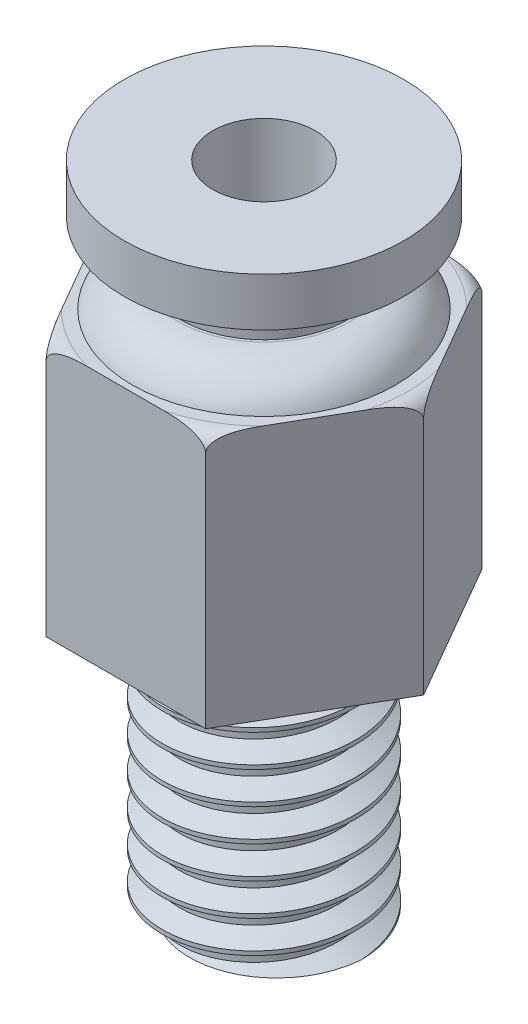
from build123d import *

# Parameters (mm, degrees)
REDONDEO1_R                  = 1.5
REDONDEO2_R                  = 0.5
ROSCA1_PITCH                 = 1
CORTAR_EXTRUIR_L_MINA3_DEPTH = 10


with BuildPart() as part:
    # Croquis1 → Revolución1 (revolve)
    with BuildSketch(Plane.XY, mode=Mode.PRIVATE) as revoluci_n1_sk:
        Polygon((-1.5875, 17), (-1.5875, 0), (-3, 0), (-3, 8.1), (-4.95, 8.1), (-4.95, 16), (-4.0875, 16), (-4.0875, 17), align=None)
    revolve(revoluci_n1_sk.sketch.rotate(Axis((0, 0, 0), (0, 1, 0)), 270), axis=Axis((0, 0, 0), (0, 1, 0)))

    # Redondeo1
    # the kernel refuses this fillet: 1.5 mm, written as the material it takes off along each edge
    with BuildSketch(Plane(origin=(0, 17, 0), x_dir=(0, 0, -1), z_dir=(1, 0, 0))) as redondeo1_piece_1:
        with BuildLine():
            CenterArc((2.673286438, -1.5), REDONDEO1_R, 19.471220634, 70.528779366)
            Line((2.673286438, 0), (2.673286438, 0.03))
            Line((2.673286438, 0.03), (4.0875, 0.03))
            Line((4.0875, 0.03), (4.1175, 0))
            ThreePointArc((4.1175, 0), (4.1175, -0.5), (4.115784271, -0.99))
            Line((4.115784271, -0.99), (4.0875, -1))
        make_face()
    revolve(axis=Axis((0, 17, 0), (0, 1, 0)), mode=Mode.SUBTRACT)

    # Redondeo2
    redondeo2_edges = [part.edges().sort_by_distance(p)[0] for p in [
        (0, 16, 4.95),
    ]]
    fillet(redondeo2_edges, radius=REDONDEO2_R)

    # Rosca1: the profile of Perfil de rosca1 profile screwed along a right-hand helix of 10 turns, 8 arcs to a turn; built about Z, then put on its axis
    rosca1_z = Axis((0, 0, 0), (0, 0, 1))
    rosca1_corners = [(3.0003, 0, -0.000173205), (3.0003, 0, 0.875173202), (2.458734125, 0, 0.562499999), (2.458734125, 0, 0.312499999)]
    with BuildLine(mode=Mode.PRIVATE) as rosca1_profile:
        Line(rosca1_corners[0], rosca1_corners[1])
        Line(rosca1_corners[1], rosca1_corners[2])
        Line(rosca1_corners[2], rosca1_corners[3])
        Line(rosca1_corners[3], rosca1_corners[0])
    rosca1_cap = Face(rosca1_profile.wire())
    rosca1_turn_angles = [0, 22.5, 45, 67.5, 90, 112.5, 135, 157.5, 180, 202.5, 225, 247.5, 270, 292.5, 315, 337.5, 360]
    rosca1_turn_weights = [1, 0.9238795325112867, 1, 0.9238795325112867, 1, 0.9238795325112867, 1, 0.9238795325112867, 1, 0.9238795325112867, 1, 0.9238795325112867, 1, 0.9238795325112867, 1, 0.9238795325112867, 1]
    rosca1_turn_rails = [Edge.make_bspline([Vector(p[0], p[1], 0).rotate(rosca1_z, rosca1_turn_angles[k]) / rosca1_turn_weights[k] + Vector(0, 0, p[2] + ROSCA1_PITCH * rosca1_turn_angles[k] / 360) for k in range(17)], [0, 0, 0, 1, 1, 2, 2, 3, 3, 4, 4, 5, 5, 6, 6, 7, 7, 8, 8, 8], 2, rosca1_turn_weights) for p in rosca1_corners]
    rosca1_turn_sides = [Face.make_surface_from_curves(rosca1_turn_rails[p[0]], rosca1_turn_rails[p[1]]) for p in [(0, 1), (1, 2), (2, 3), (3, 0)]]
    rosca1 = Plane(origin=(0, -1, 0), x_dir=(1, 0, 0), z_dir=(0, 1, 0)) * Solid(Shell([*[p.moved(Location((0, 0, ROSCA1_PITCH * i))) for i in range(10) for p in rosca1_turn_sides], rosca1_cap, rosca1_cap.rotate(rosca1_z, 3600).moved(Location((0, 0, ROSCA1_PITCH * 3600 / 360)))]))
    add(rosca1, mode=Mode.SUBTRACT)

    # Croquis5 → Revolución2 (revolve)
    with BuildSketch(Plane.XY, mode=Mode.PRIVATE) as revoluci_n2_sk:
        Polygon((-1.5875, 17), (-1.5875, 20), (-4.3375, 20), (-4.3375, 18.5), (-2.5875, 18.5), (-2.5875, 17), align=None)
    revolve(revoluci_n2_sk.sketch.rotate(Axis((0, 0, 0), (0, 1, 0)), 270), axis=Axis((0, 0, 0), (0, 1, 0)))

    # Croquis7 → Cortar-Extruir-Lámina3 (cut)
    with BuildSketch(Plane.XZ.offset(-8.1)):
        Polygon((-16.497005384, 0), (-8.248502692, -14.286825749), (8.248502692, -14.286825749), (16.497005384, 0), (8.248502692, 14.286825749), (-8.248502692, 14.286825749), align=None)
        Polygon((-4.95, 0), (-2.475, -4.286825749), (2.475, -4.286825749), (4.95, 0), (2.475, 4.286825749), (-2.475, 4.286825749), align=None, mode=Mode.SUBTRACT)
    extrude(amount=-CORTAR_EXTRUIR_L_MINA3_DEPTH, mode=Mode.SUBTRACT)


solid = part.part
